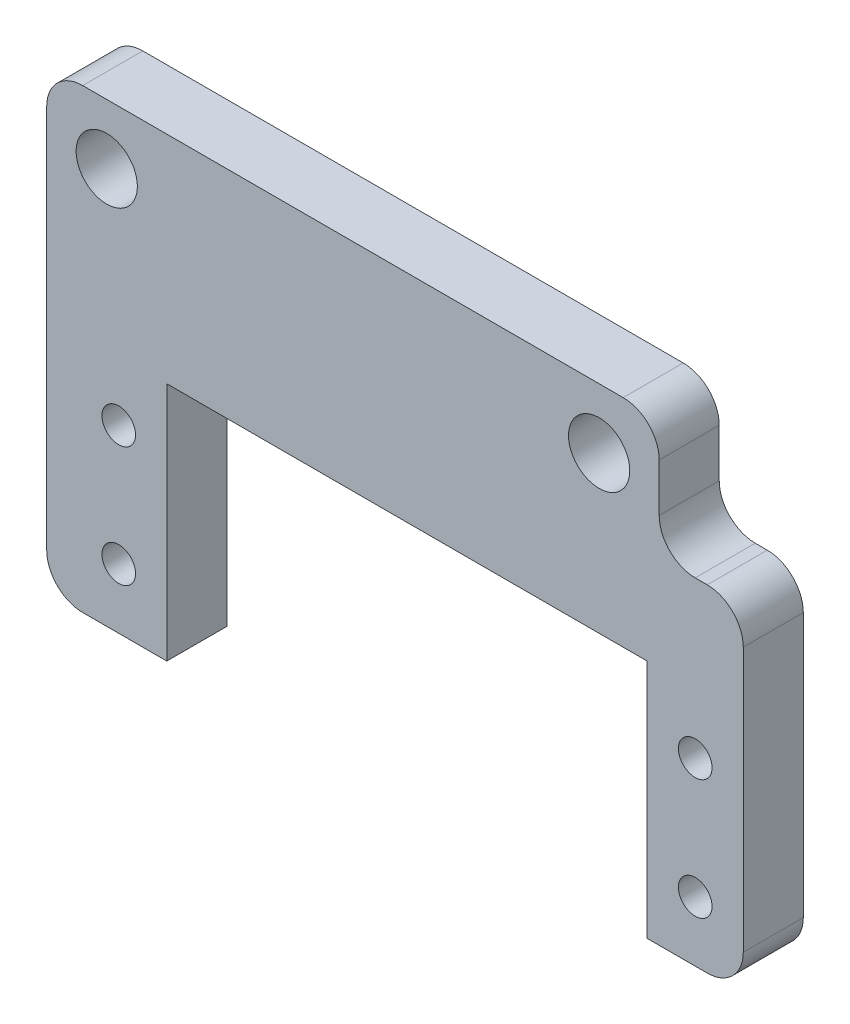
from build123d import *

# Parameters (mm, degrees)
SKETCH1_W           = 51
SKETCH1_H           = 10
SKETCH1_R           = 2.55
BOSS_EXTRUDE1_DEPTH = 5
SKETCH2_R           = 1.4
BOSS_EXTRUDE2_DEPTH = 5
FILLET1_R           = 3


with BuildPart() as part:
    # Sketch1 → Boss-Extrude1 (new body)
    with BuildSketch(Plane.XY):
        with Locations((25.5, 5)):
            Rectangle(SKETCH1_W, SKETCH1_H)
        with Locations((5, 5)):
            Circle(SKETCH1_R, mode=Mode.SUBTRACT)
        with Locations((46, 5)):
            Circle(SKETCH1_R, mode=Mode.SUBTRACT)
    extrude(amount=BOSS_EXTRUDE1_DEPTH)

    # Sketch2 → Boss-Extrude2 (add)
    with BuildSketch(Plane.XY.offset(5)):
        Polygon((10, -28), (10, -8), (50, -8), (50, -28), (58, -28), (58, 0), (51, 0), (0, 0), (0, -28), align=None)
        with Locations((6, -23)):
            Circle(SKETCH2_R, mode=Mode.SUBTRACT)
        with Locations((6, -13)):
            Circle(SKETCH2_R, mode=Mode.SUBTRACT)
        with Locations((54, -23)):
            Circle(SKETCH2_R, mode=Mode.SUBTRACT)
        with Locations((54, -13)):
            Circle(SKETCH2_R, mode=Mode.SUBTRACT)
    extrude(amount=-BOSS_EXTRUDE2_DEPTH)

    # Fillet1
    fillet1_edges = [part.edges().sort_by_distance(p)[0] for p in [
        (0, -28, 2.5),
        (58, -28, 2.5),
        (58, 0, 2.5),
        (0, 10, 2.5),
        (51, 10, 2.5),
        (51, 0, 2.5),
    ]]
    fillet(fillet1_edges, radius=FILLET1_R)


solid = part.part
